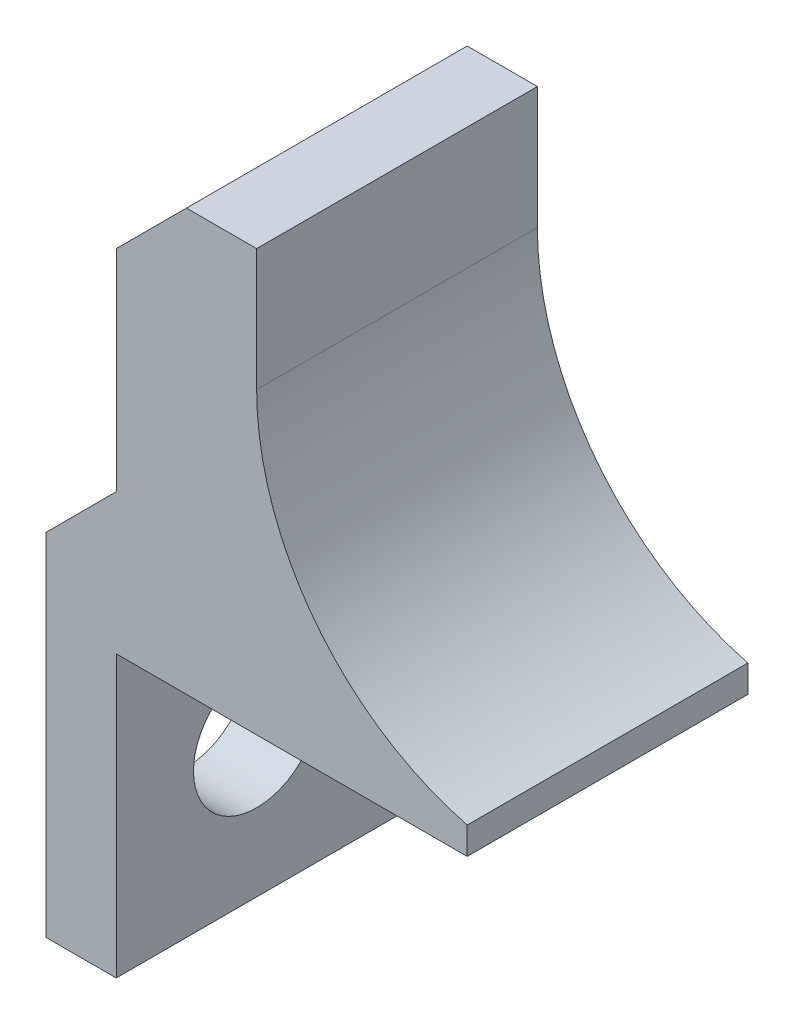
from build123d import *

# Parameters (mm, degrees)
EXTRUDE_1_DEPTH     = 20
SKETCH_3_R          = 4.5
CUT_EXTRUDE_2_DEPTH = 20
CHAMFER_1_SIZE      = 5
CHAMFER_2_SIZE      = 5


with BuildPart() as part:
    # 草图1 → 凸台-拉伸1 (new body)
    with BuildSketch(Plane.XY):
        with BuildLine():
            Line((0, 5), (0, 30))
            Line((0, 30), (10, 30))
            Line((10, 30), (10, 21.3))
            ThreePointArc((10, 21.3), (14.188611699, 9.052551286), (25, 1.935083269))
            Line((25, 1.935083269), (25, 0))
            Line((25, 0), (6.25, 0))
            Line((6.25, 0), (0, 0))
            Line((0, 0), (0, -20))
            Line((0, -20), (-5, -20))
            Line((-5, -20), (-5, 5))
            Line((-5, 5), (0, 5))
        make_face()
    extrude(amount=EXTRUDE_1_DEPTH)

    # 草图3 → 切除-拉伸2 (cut)
    with BuildSketch(Plane.ZY.offset(5)):
        with Locations((10, -10)):
            Circle(SKETCH_3_R)
    extrude(amount=-CUT_EXTRUDE_2_DEPTH, mode=Mode.SUBTRACT)

    # 倒角1
    chamfer_1_edges = [part.edges().sort_by_distance(p)[0] for p in [
        (0, 5, 10),
    ]]
    chamfer(chamfer_1_edges, length=CHAMFER_1_SIZE - 0.0001)  # a hair under: the kernel refuses the full size

    # 倒角2
    chamfer_2_edges = [part.edges().sort_by_distance(p)[0] for p in [
        (0, 30, 10),
    ]]
    chamfer(chamfer_2_edges, length=CHAMFER_2_SIZE)


solid = part.part
